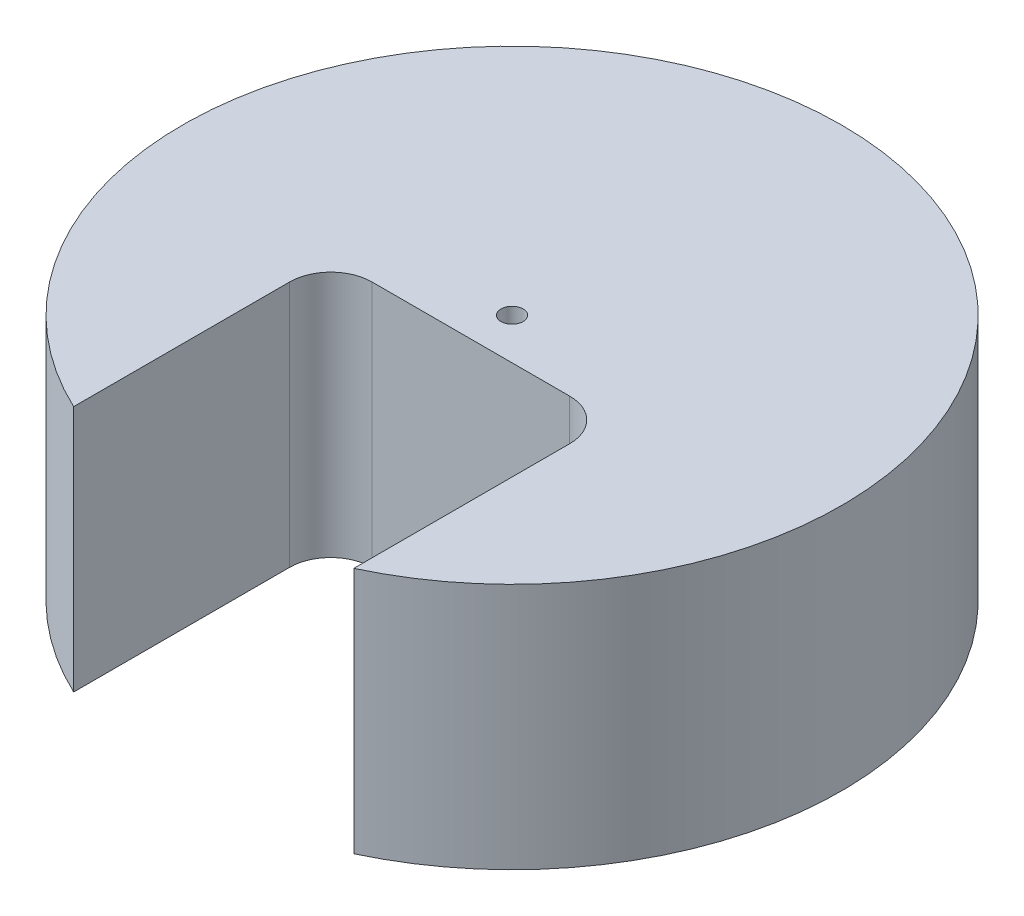
from build123d import *

# Parameters (mm, degrees)
SKETCH1_R            = 50.8
BOSS_EXTRUDE1_DEPTH  = 38.1
CUT_EXTRUDE1_REACH   = 83.32
SKETCH2_W            = 43.18
SKETCH2_H            = 44.45
FILLET1_R            = 6.35
M3_CLEARANCE_HOLE1_D = 3.4


with BuildPart() as part:
    # Sketch1 → Boss-Extrude1 (new body)
    with BuildSketch(Plane(origin=(0, 0, 0), x_dir=(1, 0, 0), z_dir=(0, 1, 0))):
        Circle(SKETCH1_R)
    extrude(amount=BOSS_EXTRUDE1_DEPTH)

    # Sketch2 → Cut-Extrude1 (cut, up to next)
    with BuildSketch(Plane(origin=(0, 38.1, 0), x_dir=(1, 0, 0), z_dir=(0, 1, 0)), mode=Mode.PRIVATE) as cut_extrude1_sk1:
        with Locations((0, -28.575)):
            Rectangle(SKETCH2_W, SKETCH2_H)
    cut_extrude1_tool1 = extrude(cut_extrude1_sk1.sketch, amount=-CUT_EXTRUDE1_REACH, mode=Mode.PRIVATE) & part.part
    add(cut_extrude1_tool1.solids().sort_by_distance((0, 38.1, 28.575))[0], mode=Mode.SUBTRACT)

    # Fillet1
    fillet1_edges = [part.edges().sort_by_distance(p)[0] for p in [
        (21.59, 19.05, 6.35),
        (-21.59, 19.05, 6.35),
    ]]
    fillet(fillet1_edges, radius=FILLET1_R)

    # M3 Clearance Hole1 (through all)
    with Locations(Plane(origin=(0, 38.1, 0), x_dir=(1, 0, 0), z_dir=(0, 1, 0))):
        with Locations((0, 0)):
            Hole(M3_CLEARANCE_HOLE1_D / 2)


solid = part.part
